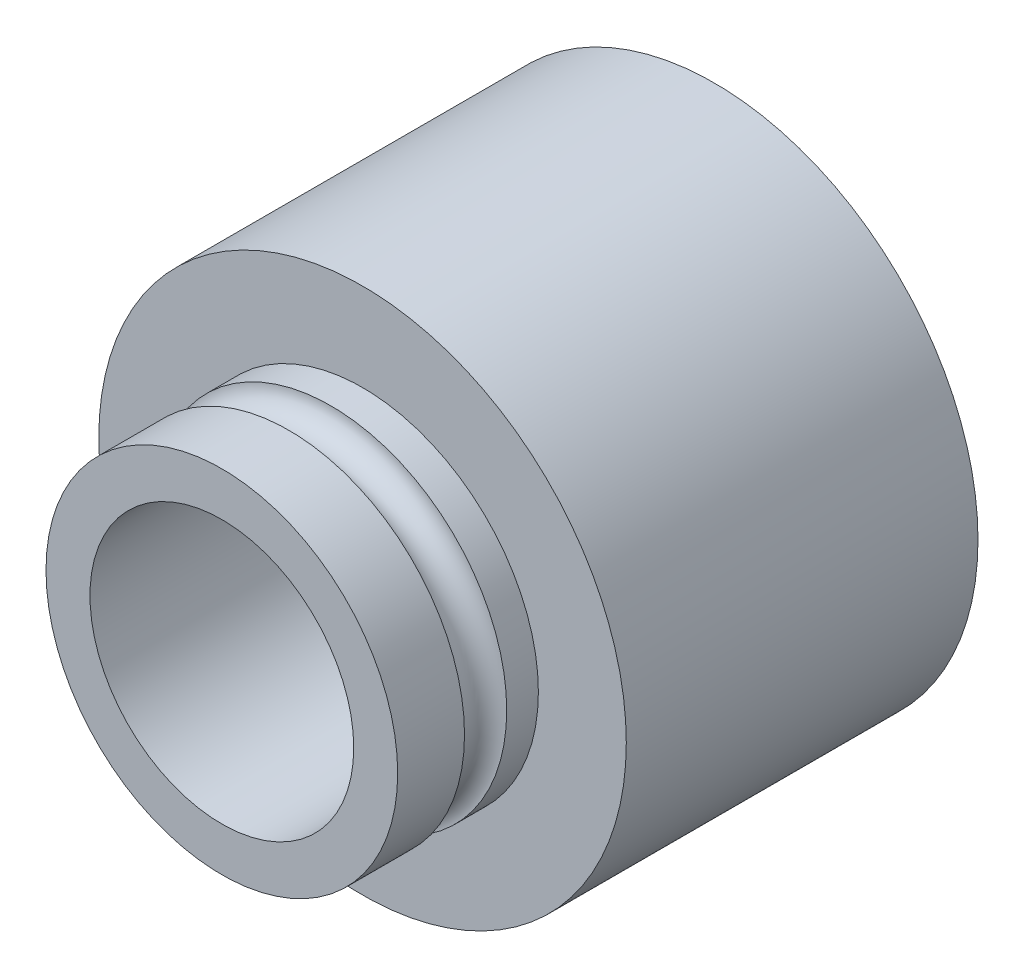
from build123d import *

# Parameters (mm, degrees)
SKETCH1_R                  = 15
BOSS_EXTRUDE1_DEPTH        = 10
SKETCH2_R                  = 10.1
CUT_EXTRUDE1_DEPTH         = 20
SKETCH3_R                  = 15
BOSS_EXTRUDE2_DEPTH        = 10
SKETCH5_R                  = 10
CUT_EXTRUDE3_DEPTH         = 8
SKETCH8_W                  = 0.75
SKETCH8_H                  = 0.75
CUT_EXTRUDE5_DEPTH         = 2
FILL_START                 = -1.125
FILL_PATTERN2_OUTLINE_W    = 0.75
FILL_PATTERN2_OUTLINE_H    = 2
FILL_PATTERN2_DEPTH        = 0.75
FILL_START_2               = 0.375
FILL_PATTERN2_2_OUTLINE_W  = 0.75
FILL_PATTERN2_2_OUTLINE_H  = 2
FILL_PATTERN2_2_DEPTH      = 0.75
FILL_START_3               = -3.375
FILL_PATTERN2_3_OUTLINE_W  = 0.75
FILL_PATTERN2_3_OUTLINE_H  = 2
FILL_PATTERN2_3_DEPTH      = 0.75
FILL_START_4               = -1.875
FILL_PATTERN2_4_OUTLINE_W  = 0.75
FILL_PATTERN2_4_OUTLINE_H  = 2
FILL_PATTERN2_4_DEPTH      = 0.75
FILL_START_5               = 1.125
FILL_PATTERN2_5_OUTLINE_W  = 0.75
FILL_PATTERN2_5_OUTLINE_H  = 2
FILL_PATTERN2_5_DEPTH      = 0.75
FILL_START_6               = 2.625
FILL_PATTERN2_6_OUTLINE_W  = 0.75
FILL_PATTERN2_6_OUTLINE_H  = 2
FILL_PATTERN2_6_DEPTH      = 0.75
FILL_START_7               = -4.125
FILL_PATTERN2_7_OUTLINE_W  = 0.75
FILL_PATTERN2_7_OUTLINE_H  = 2
FILL_PATTERN2_7_DEPTH      = 0.75
FILL_START_8               = -2.625
FILL_PATTERN2_8_OUTLINE_W  = 0.75
FILL_PATTERN2_8_OUTLINE_H  = 2
FILL_PATTERN2_8_DEPTH      = 0.75
FILL_START_9               = -0.375
FILL_PATTERN2_9_OUTLINE_W  = 0.75
FILL_PATTERN2_9_OUTLINE_H  = 2
FILL_PATTERN2_9_DEPTH      = 0.75
FILL_START_10              = 1.875
FILL_PATTERN2_10_OUTLINE_W = 0.75
FILL_PATTERN2_10_OUTLINE_H = 2
FILL_PATTERN2_10_DEPTH     = 0.75
FILL_START_11              = 3.375
FILL_PATTERN2_11_OUTLINE_W = 0.75
FILL_PATTERN2_11_OUTLINE_H = 2
FILL_PATTERN2_11_DEPTH     = 0.75
SKETCH15_W                 = 16
SKETCH15_H                 = 2.5
SKETCH16_R                 = 1.2


# Read off the part's stored shape, not the designer's step: Fill Pattern2
with BuildPart() as part:
    # Sketch1 → Boss-Extrude1 (new body)
    with BuildSketch(Plane.XY):
        Circle(SKETCH1_R)
    extrude(amount=BOSS_EXTRUDE1_DEPTH)

    # Sketch2 → Cut-Extrude1 (cut)
    with BuildSketch(Plane.XY.offset(10)):
        Circle(SKETCH2_R)
    extrude(amount=-CUT_EXTRUDE1_DEPTH, mode=Mode.SUBTRACT)

    # Sketch3 → Boss-Extrude2 (add)
    with BuildSketch(Plane.XY.offset(10)):
        Circle(SKETCH3_R)
    extrude(amount=BOSS_EXTRUDE2_DEPTH)

    # Sketch5 → Cut-Extrude3 (cut)
    with BuildSketch(Plane.XY.offset(20)):
        Circle(SKETCH5_R)
    extrude(amount=-CUT_EXTRUDE3_DEPTH, mode=Mode.SUBTRACT)

    # Sketch8 → Cut-Extrude5 (cut)
    with BuildSketch(Plane(origin=(0, 0, 10), x_dir=(-1, 0, 0), z_dir=(0, 0, -1))):
        Rectangle(SKETCH8_W, SKETCH8_H)
    extrude(amount=-CUT_EXTRUDE5_DEPTH, mode=Mode.SUBTRACT)

    # Fill Pattern2 outline → Fill Pattern2 (cut)
    with BuildSketch(Plane.YZ.offset(FILL_START)):
        with Locations((-1.299038106, 11)):
            Rectangle(FILL_PATTERN2_OUTLINE_W, FILL_PATTERN2_OUTLINE_H)
        with Locations((1.299038106, 11)):
            Rectangle(FILL_PATTERN2_OUTLINE_W, FILL_PATTERN2_OUTLINE_H)
        with Locations((-3.897114317, 11)):
            Rectangle(FILL_PATTERN2_OUTLINE_W, FILL_PATTERN2_OUTLINE_H)
        with Locations((3.897114317, 11)):
            Rectangle(FILL_PATTERN2_OUTLINE_W, FILL_PATTERN2_OUTLINE_H)
    extrude(amount=FILL_PATTERN2_DEPTH, mode=Mode.SUBTRACT)

    # Fill Pattern2 2 outline → Fill Pattern2 2 (cut)
    with BuildSketch(Plane.YZ.offset(FILL_START_2)):
        with Locations((-1.299038106, 11)):
            Rectangle(FILL_PATTERN2_2_OUTLINE_W, FILL_PATTERN2_2_OUTLINE_H)
        with Locations((1.299038106, 11)):
            Rectangle(FILL_PATTERN2_2_OUTLINE_W, FILL_PATTERN2_2_OUTLINE_H)
        with Locations((-3.897114317, 11)):
            Rectangle(FILL_PATTERN2_2_OUTLINE_W, FILL_PATTERN2_2_OUTLINE_H)
        with Locations((3.897114317, 11)):
            Rectangle(FILL_PATTERN2_2_OUTLINE_W, FILL_PATTERN2_2_OUTLINE_H)
    extrude(amount=FILL_PATTERN2_2_DEPTH, mode=Mode.SUBTRACT)

    # Fill Pattern2 3 outline → Fill Pattern2 3 (cut)
    with BuildSketch(Plane.YZ.offset(FILL_START_3)):
        with Locations((0, 11)):
            Rectangle(FILL_PATTERN2_3_OUTLINE_W, FILL_PATTERN2_3_OUTLINE_H)
        with Locations((-2.598076211, 11)):
            Rectangle(FILL_PATTERN2_3_OUTLINE_W, FILL_PATTERN2_3_OUTLINE_H)
        with Locations((2.598076211, 11)):
            Rectangle(FILL_PATTERN2_3_OUTLINE_W, FILL_PATTERN2_3_OUTLINE_H)
    extrude(amount=FILL_PATTERN2_3_DEPTH, mode=Mode.SUBTRACT)

    # Fill Pattern2 4 outline → Fill Pattern2 4 (cut)
    with BuildSketch(Plane.YZ.offset(FILL_START_4)):
        with Locations((0, 11)):
            Rectangle(FILL_PATTERN2_4_OUTLINE_W, FILL_PATTERN2_4_OUTLINE_H)
        with Locations((-2.598076211, 11)):
            Rectangle(FILL_PATTERN2_4_OUTLINE_W, FILL_PATTERN2_4_OUTLINE_H)
        with Locations((2.598076211, 11)):
            Rectangle(FILL_PATTERN2_4_OUTLINE_W, FILL_PATTERN2_4_OUTLINE_H)
    extrude(amount=FILL_PATTERN2_4_DEPTH, mode=Mode.SUBTRACT)

    # Fill Pattern2 5 outline → Fill Pattern2 5 (cut)
    with BuildSketch(Plane.YZ.offset(FILL_START_5)):
        with Locations((0, 11)):
            Rectangle(FILL_PATTERN2_5_OUTLINE_W, FILL_PATTERN2_5_OUTLINE_H)
        with Locations((-2.598076211, 11)):
            Rectangle(FILL_PATTERN2_5_OUTLINE_W, FILL_PATTERN2_5_OUTLINE_H)
        with Locations((2.598076211, 11)):
            Rectangle(FILL_PATTERN2_5_OUTLINE_W, FILL_PATTERN2_5_OUTLINE_H)
    extrude(amount=FILL_PATTERN2_5_DEPTH, mode=Mode.SUBTRACT)

    # Fill Pattern2 6 outline → Fill Pattern2 6 (cut)
    with BuildSketch(Plane.YZ.offset(FILL_START_6)):
        with Locations((0, 11)):
            Rectangle(FILL_PATTERN2_6_OUTLINE_W, FILL_PATTERN2_6_OUTLINE_H)
        with Locations((-2.598076211, 11)):
            Rectangle(FILL_PATTERN2_6_OUTLINE_W, FILL_PATTERN2_6_OUTLINE_H)
        with Locations((2.598076211, 11)):
            Rectangle(FILL_PATTERN2_6_OUTLINE_W, FILL_PATTERN2_6_OUTLINE_H)
    extrude(amount=FILL_PATTERN2_6_DEPTH, mode=Mode.SUBTRACT)

    # Fill Pattern2 7 outline → Fill Pattern2 7 (cut)
    with BuildSketch(Plane.YZ.offset(FILL_START_7)):
        with Locations((-1.299038106, 11)):
            Rectangle(FILL_PATTERN2_7_OUTLINE_W, FILL_PATTERN2_7_OUTLINE_H)
        with Locations((1.299038106, 11)):
            Rectangle(FILL_PATTERN2_7_OUTLINE_W, FILL_PATTERN2_7_OUTLINE_H)
    extrude(amount=FILL_PATTERN2_7_DEPTH, mode=Mode.SUBTRACT)

    # Fill Pattern2 8 outline → Fill Pattern2 8 (cut)
    with BuildSketch(Plane.YZ.offset(FILL_START_8)):
        with Locations((-1.299038106, 11)):
            Rectangle(FILL_PATTERN2_8_OUTLINE_W, FILL_PATTERN2_8_OUTLINE_H)
        with Locations((1.299038106, 11)):
            Rectangle(FILL_PATTERN2_8_OUTLINE_W, FILL_PATTERN2_8_OUTLINE_H)
    extrude(amount=FILL_PATTERN2_8_DEPTH, mode=Mode.SUBTRACT)

    # Fill Pattern2 9 outline → Fill Pattern2 9 (cut)
    with BuildSketch(Plane.YZ.offset(FILL_START_9)):
        with Locations((-2.598076211, 11)):
            Rectangle(FILL_PATTERN2_9_OUTLINE_W, FILL_PATTERN2_9_OUTLINE_H)
        with Locations((2.598076211, 11)):
            Rectangle(FILL_PATTERN2_9_OUTLINE_W, FILL_PATTERN2_9_OUTLINE_H)
    extrude(amount=FILL_PATTERN2_9_DEPTH, mode=Mode.SUBTRACT)

    # Fill Pattern2 10 outline → Fill Pattern2 10 (cut)
    with BuildSketch(Plane.YZ.offset(FILL_START_10)):
        with Locations((-1.299038106, 11)):
            Rectangle(FILL_PATTERN2_10_OUTLINE_W, FILL_PATTERN2_10_OUTLINE_H)
        with Locations((1.299038106, 11)):
            Rectangle(FILL_PATTERN2_10_OUTLINE_W, FILL_PATTERN2_10_OUTLINE_H)
    extrude(amount=FILL_PATTERN2_10_DEPTH, mode=Mode.SUBTRACT)

    # Fill Pattern2 11 outline → Fill Pattern2 11 (cut)
    with BuildSketch(Plane.YZ.offset(FILL_START_11)):
        with Locations((-1.299038106, 11)):
            Rectangle(FILL_PATTERN2_11_OUTLINE_W, FILL_PATTERN2_11_OUTLINE_H)
        with Locations((1.299038106, 11)):
            Rectangle(FILL_PATTERN2_11_OUTLINE_W, FILL_PATTERN2_11_OUTLINE_H)
    extrude(amount=FILL_PATTERN2_11_DEPTH, mode=Mode.SUBTRACT)

    # Sketch15 → Revolve2 (revolve)
    with BuildSketch(Plane(origin=(0, 0, 0), x_dir=(0, 0, -1), z_dir=(1, 0, 0)), mode=Mode.PRIVATE) as revolve2_sk:
        with Locations((-20, -8.75)):
            Rectangle(SKETCH15_W, SKETCH15_H)
    revolve(revolve2_sk.sketch.rotate(Axis((0, 0, 20), (0, 0, -1)), 270), axis=Axis((0, 0, 20), (0, 0, -1)))

    # Sketch16 → Cut-Revolve2 (revolve, cut)
    with BuildSketch(Plane(origin=(0, 0, 0), x_dir=(0, 0, -1), z_dir=(1, 0, 0)), mode=Mode.PRIVATE) as cut_revolve2_sk:
        with Locations((-23, 10)):
            Circle(SKETCH16_R)
    revolve(cut_revolve2_sk.sketch.rotate(Axis((0, 0, 20), (0, 0, -1)), 90), axis=Axis((0, 0, 20), (0, 0, -1)), mode=Mode.SUBTRACT)


solid = part.part
